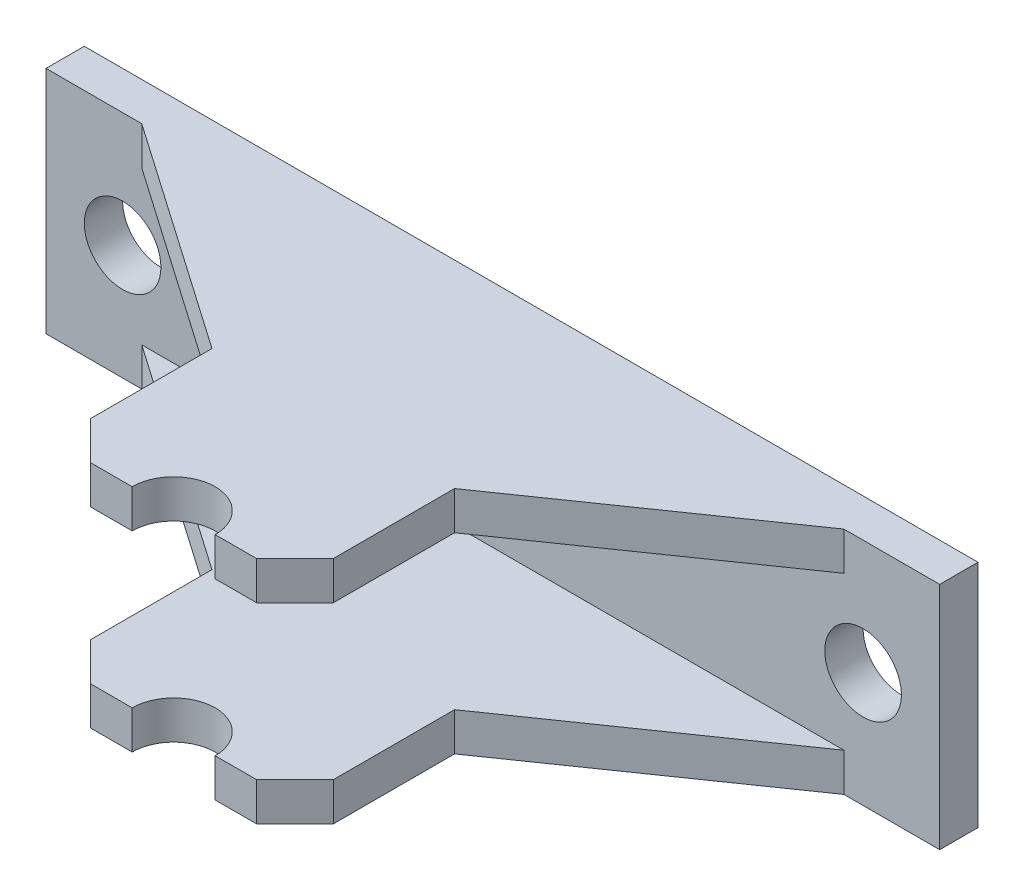
from build123d import *

# Parameters (mm, degrees)
BOSS_EXTRUDE1_DEPTH = 3
SKETCH2_W           = 70
SKETCH2_H           = 18
SKETCH2_R           = 3
BOSS_EXTRUDE2_DEPTH = 3
CHAMFER1_SIZE       = 3


with BuildPart() as part:
    # Sketch1 → Boss-Extrude1 (new body)
    with BuildSketch(Plane(origin=(0, 0, 0), x_dir=(1, 0, 0), z_dir=(0, 1, 0))):
        with BuildLine():
            Line((0, 25), (55, 25))
            Line((55, 25), (37, 12.5))
            Line((37, 12.5), (37, 0))
            Line((37, 0), (30.75, 0))
            ThreePointArc((30.75, 0), (27.5, 3.25), (24.25, 0))
            Line((24.25, 0), (18, 0))
            Line((18, 0), (18, 12.5))
            Line((18, 12.5), (0, 25))
        make_face()
    boss_extrude1 = extrude(amount=BOSS_EXTRUDE1_DEPTH)

    # Sketch2 → Boss-Extrude2 (add)
    with BuildSketch(Plane(origin=(0, 0, -25), x_dir=(-1, 0, 0), z_dir=(0, 0, -1))):
        with Locations((-27.5, -6)):
            Rectangle(SKETCH2_W, SKETCH2_H)
        with Locations((-56.5, -6)):
            Circle(SKETCH2_R, mode=Mode.SUBTRACT)
        with Locations((1.5, -6)):
            Circle(SKETCH2_R, mode=Mode.SUBTRACT)
    extrude(amount=BOSS_EXTRUDE2_DEPTH)

    # Mirror1: Boss-Extrude1 across plane
    add(boss_extrude1.mirror(Plane.ZX.offset(-6)))

    # Chamfer1
    chamfer1_edges = [part.edges().sort_by_distance(p)[0] for p in [
        (37, 1.5, 0),
        (18, 1.5, 0),
        (37, -13.5, 0),
        (18, -13.5, 0),
    ]]
    chamfer(chamfer1_edges, length=CHAMFER1_SIZE)


solid = part.part
